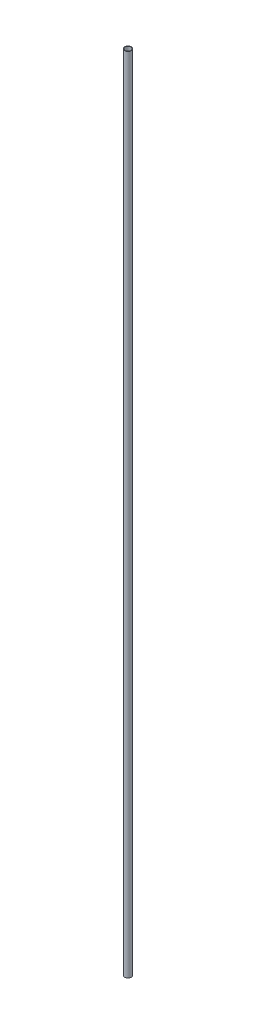
from build123d import *

# Parameters (mm, degrees)
SKETCH1_R           = 4
SKETCH1_R_2         = 3.5
BOSS_EXTRUDE1_DEPTH = 955.88


with BuildPart() as part:
    # Sketch1 → Boss-Extrude1 (new body)
    with BuildSketch(Plane(origin=(0, 0, 0), x_dir=(1, 0, 0), z_dir=(0, 1, 0))):
        Circle(SKETCH1_R)
        Circle(SKETCH1_R_2, mode=Mode.SUBTRACT)
    extrude(amount=BOSS_EXTRUDE1_DEPTH)


solid = part.part
